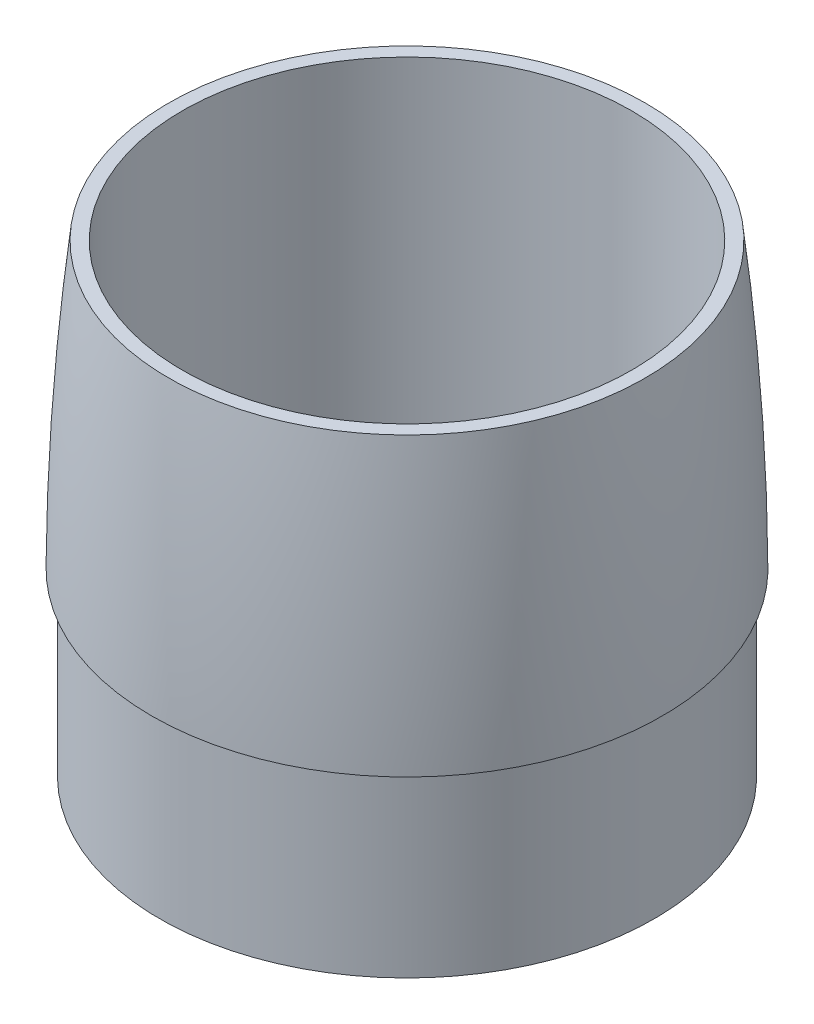
from build123d import *

# Parameters (mm, degrees)
CROQUIS3_R            = 68.895273635
CORTAR_EXTRUIR3_DEPTH = 204.307108224


with BuildPart() as part:
    # Croquis1 → Revolución1 (revolve)
    with BuildSketch(Plane(origin=(0, 0, 0), x_dir=(0, 0, -1), z_dir=(1, 0, 0))):
        with BuildLine():
            Line((50, 12), (50, 103.234638666))
            ThreePointArc((50, 103.234638666), (32.109347109, 195.035557404), (0, 282.879020282))
            Line((0, 282.879020282), (0, 290))
            ThreePointArc((0, 290), (42.008882213, 168.091938039), (56.8, 40))
            Line((56.8, 40), (55, 40))
            Line((55, 40), (55, 0))
            Line((55, 0), (50, 0))
            Line((50, 0), (0, 0))
            Line((0, 0), (0, 12))
            Line((0, 12), (50, 12))
        make_face()
    revolve(axis=Axis((0, 0, 0), (0, 1, 0)))

    # Croquis3 → Cortar-Extruir3 (cut, through all)
    with BuildSketch(Plane(origin=(0, 103.234638666, 0), x_dir=(-1, 0, 0), z_dir=(0, -1, 0))):
        Circle(CROQUIS3_R)
    extrude(amount=-CORTAR_EXTRUIR3_DEPTH, mode=Mode.SUBTRACT)


solid = part.part
